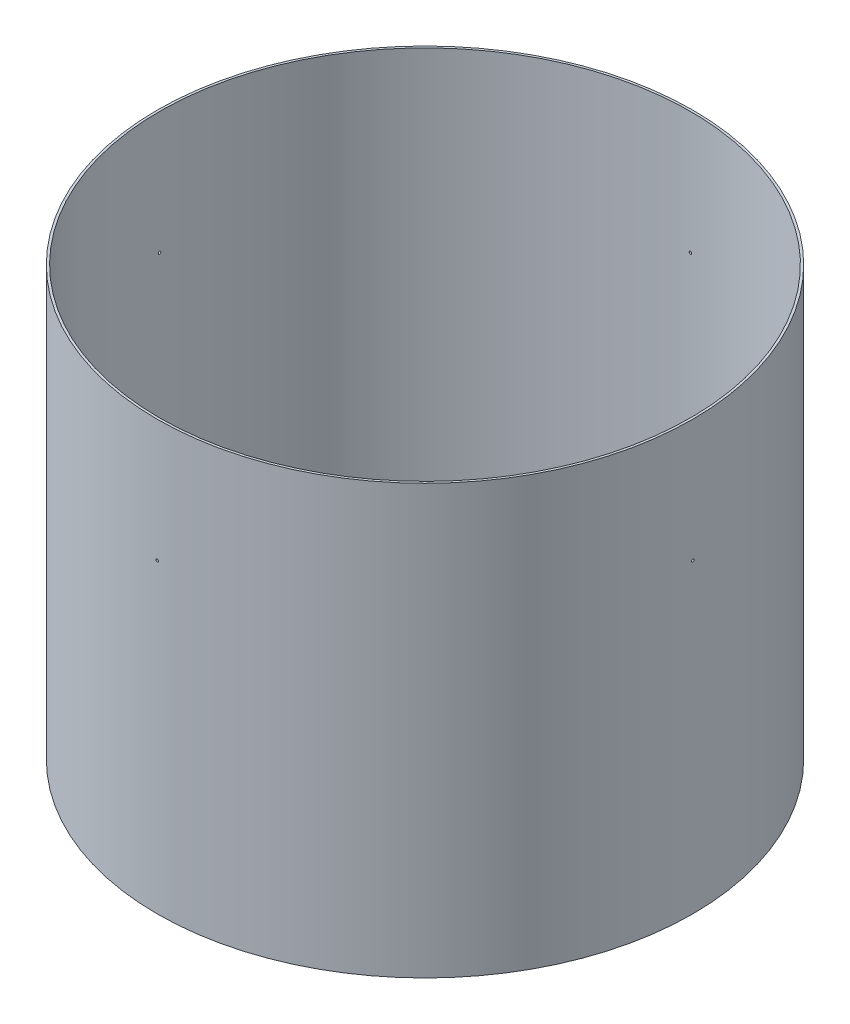
from build123d import *

# Parameters (mm, degrees)
SKETCH9_R           = 1750
BOSS_EXTRUDE5_DEPTH = 2800
CUT_EXTRUDE11_START = 1700
SKETCH19_R          = 8.382
CUT_EXTRUDE11_DEPTH = 400
SKETCH20_R          = 1735
CUT_EXTRUDE12_DEPTH = 2785
CIRPATTERN1_COUNT   = 4


with BuildPart() as part:
    # Sketch9 → Boss-Extrude5 (new body)
    with BuildSketch(Plane(origin=(0, 0, 0), x_dir=(1, 0, 0), z_dir=(0, 1, 0))):
        Circle(SKETCH9_R)
    extrude(amount=BOSS_EXTRUDE5_DEPTH)

    # Sketch19 → Cut-Extrude11 (cut)
    with BuildSketch(Plane.XY.offset(CUT_EXTRUDE11_START)):
        with Locations((0, 2000)):
            Circle(SKETCH19_R)
    cut_extrude11 = extrude(amount=CUT_EXTRUDE11_DEPTH, mode=Mode.SUBTRACT)

    # Sketch20 → Cut-Extrude12 (cut)
    with BuildSketch(Plane(origin=(0, 2800, 0), x_dir=(1, 0, 0), z_dir=(0, 1, 0))):
        Circle(SKETCH20_R)
    extrude(amount=-CUT_EXTRUDE12_DEPTH, mode=Mode.SUBTRACT)

    # CirPattern1: Cut-Extrude11 ×4 about axis
    cirpattern1_axis = Axis((0, 2800, 0), (0, -1, 0))
    for i in range(1, CIRPATTERN1_COUNT):
        add(cut_extrude11.rotate(cirpattern1_axis, i * 360 / CIRPATTERN1_COUNT), mode=Mode.SUBTRACT)


solid = part.part
